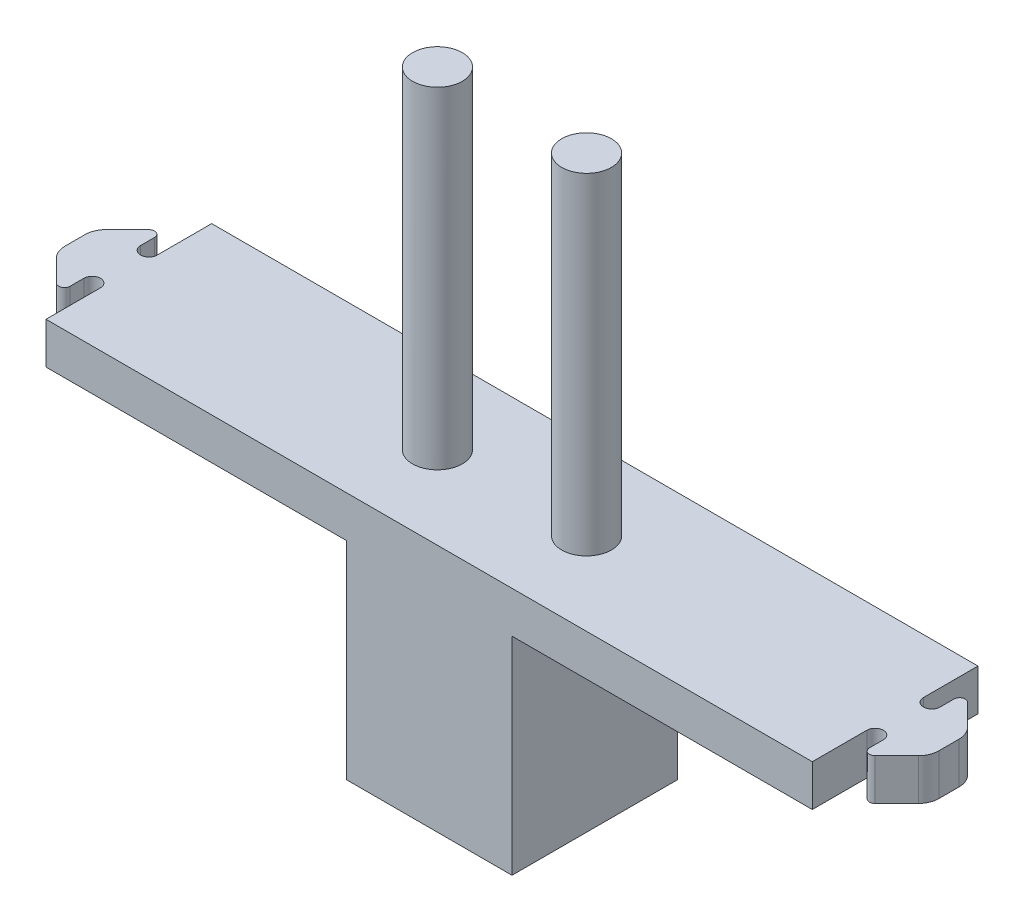
from build123d import *

# Parameters (mm, degrees)
SKETCH1_W           = 117.475
SKETCH1_H           = 25.4
BOSS_EXTRUDE1_DEPTH = 6.35
SKETCH3_R           = 3.81
BOSS_EXTRUDE2_DEPTH = 50.8
BOSS_EXTRUDE7_DEPTH = 6.35
SKETCH12_W          = 25.4
SKETCH12_H          = 25.4
BOSS_EXTRUDE8_DEPTH = 31.75


with BuildPart() as part:
    # Sketch1 → Boss-Extrude1 (new body)
    with BuildSketch(Plane(origin=(0, 0, 0), x_dir=(1, 0, 0), z_dir=(0, 1, 0))):
        with Locations((-58.7375, -12.7)):
            Rectangle(SKETCH1_W, SKETCH1_H)
    extrude(amount=BOSS_EXTRUDE1_DEPTH)

    # Sketch3 → Boss-Extrude2 (add)
    with BuildSketch(Plane(origin=(0, 6.35, 0), x_dir=(1, 0, 0), z_dir=(0, 1, 0))):
        with Locations((-47.3075, -12.7)):
            Circle(SKETCH3_R)
        with Locations((-70.1675, -12.7)):
            Circle(SKETCH3_R)
    extrude(amount=BOSS_EXTRUDE2_DEPTH)

    # Sketch10 → Boss-Extrude7 (add)
    with BuildSketch(Plane(origin=(0, 6.35, 0), x_dir=(1, 0, 0), z_dir=(0, 1, 0))):
        with BuildLine():
            Line((0, -12.7), (0, -8.3566))
            ThreePointArc((0, -8.3566), (1.27, -9.6266), (2.54, -8.3566))
            Line((2.54, -8.3566), (2.54, -6.223))
            ThreePointArc((2.54, -6.223), (3.073114588, -5.425137636), (4.014257416, -5.612342584))
            Line((4.014257416, -5.612342584), (7.336952181, -8.935037349))
            ThreePointArc((7.336952181, -8.935037349), (8.017998618, -9.969860776), (8.2511937, -11.186538149))
            Line((8.2511937, -11.186538149), (8.2511937, -12.7))
            Line((8.2511937, -12.7), (0, -12.7))
        make_face()
        with BuildLine():
            Line((-117.475, -12.7), (-117.475, -8.3566))
            ThreePointArc((-117.475, -8.3566), (-118.745, -9.6266), (-120.015, -8.3566))
            Line((-120.015, -8.3566), (-120.015, -6.223))
            ThreePointArc((-120.015, -6.223), (-120.548114588, -5.425137636), (-121.489257416, -5.612342584))
            Line((-121.489257416, -5.612342584), (-124.811952181, -8.935037349))
            ThreePointArc((-124.811952181, -8.935037349), (-125.492998618, -9.969860776), (-125.7261937, -11.186538149))
            Line((-125.7261937, -11.186538149), (-125.7261937, -12.7))
            Line((-125.7261937, -12.7), (-117.475, -12.7))
        make_face()
    boss_extrude7 = extrude(amount=-BOSS_EXTRUDE7_DEPTH)

    # Mirror1: Boss-Extrude7 across plane
    add(boss_extrude7.mirror(Plane(origin=(8.2511937, 0, 12.7), x_dir=(1, 0, 0), z_dir=(0, 0, 1))))

    # Sketch12 → Boss-Extrude8 (add)
    with BuildSketch(Plane(origin=(0, 0, 0), x_dir=(-1, 0, 0), z_dir=(0, -1, 0))):
        with Locations((58.7375, -12.7)):
            Rectangle(SKETCH12_W, SKETCH12_H)
    extrude(amount=BOSS_EXTRUDE8_DEPTH)


solid = part.part
